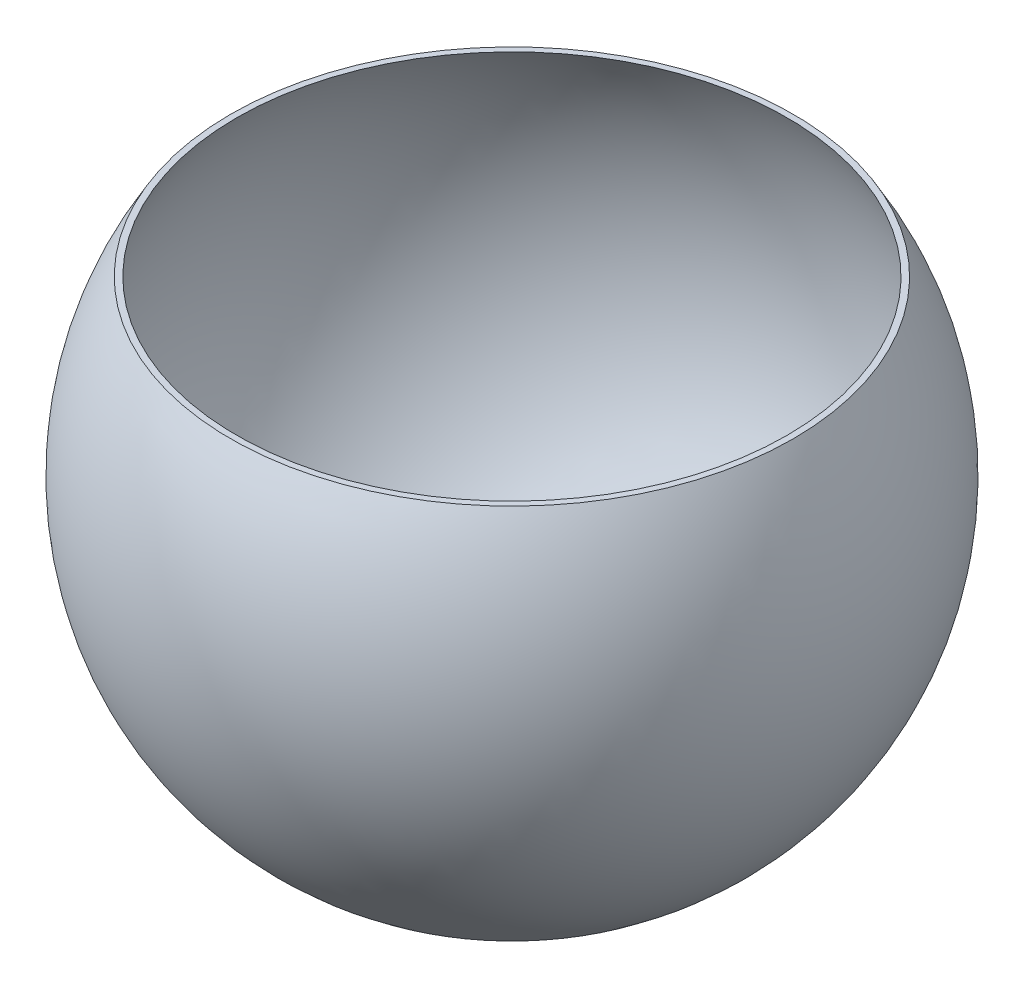
from build123d import *


with BuildPart() as part:
    # Sketch1 → Revolve1 (revolve)
    with BuildSketch(Plane.XY):
        with BuildLine():
            Line((173.36215491, 178.868849685), (169.629588751, 178.868849685))
            ThreePointArc((169.629588751, 178.868849685), (174.94637033, -24.103250088), (0, -127.155222222))
            Line((0, -127.155222222), (0, -130.330222222))
            ThreePointArc((0, -130.330222222), (177.241715478, -26.506347596), (173.36215491, 178.868849685))
        make_face()
    revolve(axis=Axis((0, 0, 0), (0, -1, 0)))


solid = part.part
